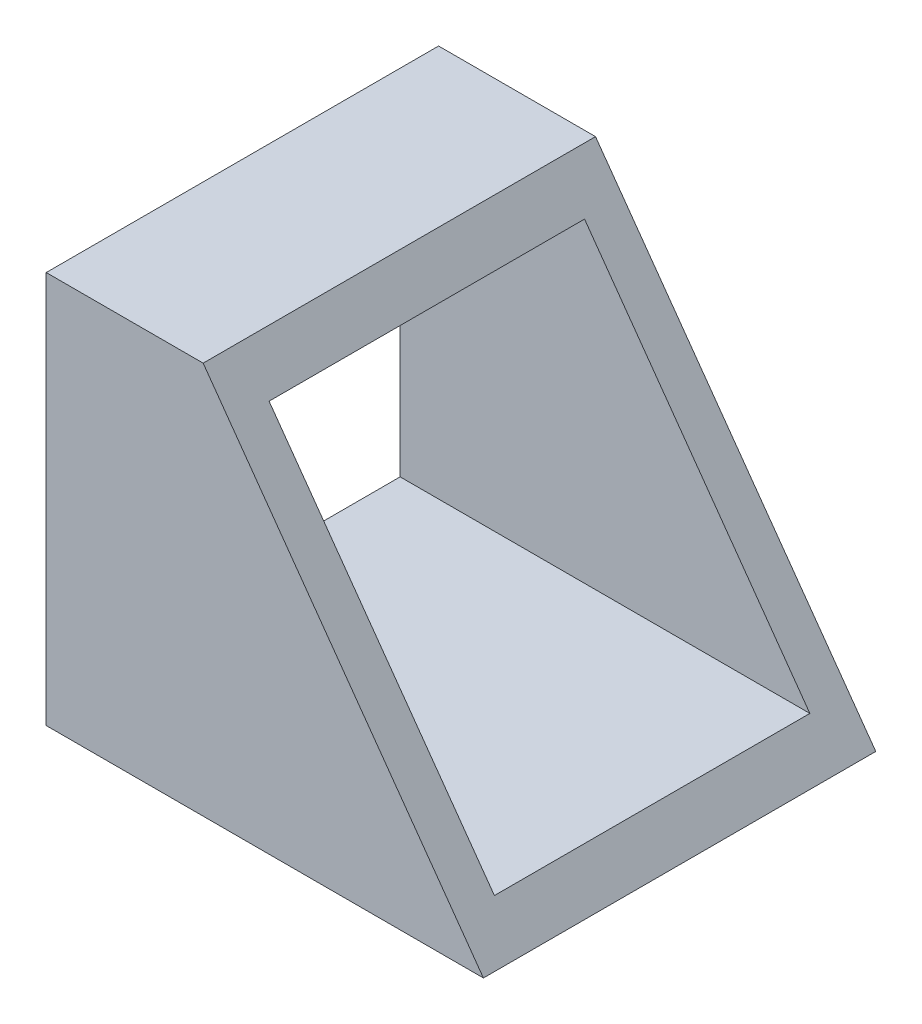
from build123d import *

# Parameters (mm, degrees)
BOSS_EXTRUDE1_START       = 663.104666785
BOSS_EXTRUDE1_OUTLINE_W   = 25
BOSS_EXTRUDE1_OUTLINE_H   = 25
BOSS_EXTRUDE1_OUTLINE_W_2 = 20.1
BOSS_EXTRUDE1_OUTLINE_H_2 = 20.1
BOSS_EXTRUDE1_DEPTH       = 27.857142858
BOSS_EXTRUDE1_START_2     = 1064
BOSS_EXTRUDE1_2_OUTLINE_W = 39
BOSS_EXTRUDE1_2_OUTLINE_H = 25
BOSS_EXTRUDE1_2_DEPTH     = 15.171213372
BOSS_EXTRUDE1_START_3     = 1087.308548084
BOSS_EXTRUDE1_3_OUTLINE_W = 39
BOSS_EXTRUDE1_3_OUTLINE_H = 25
BOSS_EXTRUDE1_3_DEPTH     = 15.691451916
BOSS_EXTRUDE2_DEPTH       = 25
CUT_EXTRUDE2_REACH        = 1648.145
SKETCH7_W                 = 20.1
SKETCH7_H                 = 20.1


with BuildPart() as part:
    # Boss-Extrude1: read off the stored shape, not the designer's step
    # Boss-Extrude1 outline → Boss-Extrude1 (new body)
    with BuildSketch(Plane(origin=(0, 0, 0), x_dir=(0, 0, -1), z_dir=(1, 0, 0)).offset(BOSS_EXTRUDE1_START)):
        with Locations((-1346.624663727, 915.829825752)):
            Rectangle(BOSS_EXTRUDE1_OUTLINE_W, BOSS_EXTRUDE1_OUTLINE_H)
        with Locations((-1346.624663727, 915.829825752)):
            Rectangle(BOSS_EXTRUDE1_OUTLINE_W_2, BOSS_EXTRUDE1_OUTLINE_H_2, mode=Mode.SUBTRACT)
    extrude(amount=BOSS_EXTRUDE1_DEPTH)

    # Boss-Extrude1 2 outline → Boss-Extrude1 2 (cut)
    with BuildSketch(Plane(origin=(0, 0, 0), x_dir=(0.5812381937190959, -0.8137334712067352, 0), z_dir=(0.8137334712067352, 0.5812381937190961, 0)).offset(BOSS_EXTRUDE1_START_2)):
        with Locations((-351.5, -1346.624663727)):
            Rectangle(BOSS_EXTRUDE1_2_OUTLINE_W, BOSS_EXTRUDE1_2_OUTLINE_H)
    extrude(amount=BOSS_EXTRUDE1_2_DEPTH, mode=Mode.SUBTRACT)

    # Boss-Extrude1 3 outline → Boss-Extrude1 3 (cut)
    with BuildSketch(Plane(origin=(0, 0, 0), x_dir=(0.5812381937190959, -0.8137334712067352, 0), z_dir=(0.8137334712067352, 0.5812381937190961, 0)).offset(BOSS_EXTRUDE1_START_3)):
        with Locations((-351.5, -1346.624663727)):
            Rectangle(BOSS_EXTRUDE1_3_OUTLINE_W, BOSS_EXTRUDE1_3_OUTLINE_H)
    extrude(amount=BOSS_EXTRUDE1_3_DEPTH, mode=Mode.SUBTRACT)

    # Sketch5 → Boss-Extrude2 (add)
    with BuildSketch(Plane.XY.offset(1359.124663727)):
        Polygon((663.104666785, 928.329825752), (680.961809643, 903.329825752), (663.104666785, 903.329825752), align=None)
    extrude(amount=-BOSS_EXTRUDE2_DEPTH)

    # Sketch7 → Cut-Extrude2 (cut, up to next)
    with BuildSketch(Plane.ZY.offset(-663.104666785), mode=Mode.PRIVATE) as cut_extrude2_sk1:
        with Locations((1346.624663727, 915.829825752)):
            Rectangle(SKETCH7_W, SKETCH7_H)
    cut_extrude2_tool1 = extrude(cut_extrude2_sk1.sketch, amount=-CUT_EXTRUDE2_REACH, mode=Mode.PRIVATE) & part.part
    add(cut_extrude2_tool1.solids().sort_by_distance((663.104667, 915.829826, 1346.624664))[0], mode=Mode.SUBTRACT)


solid = part.part
